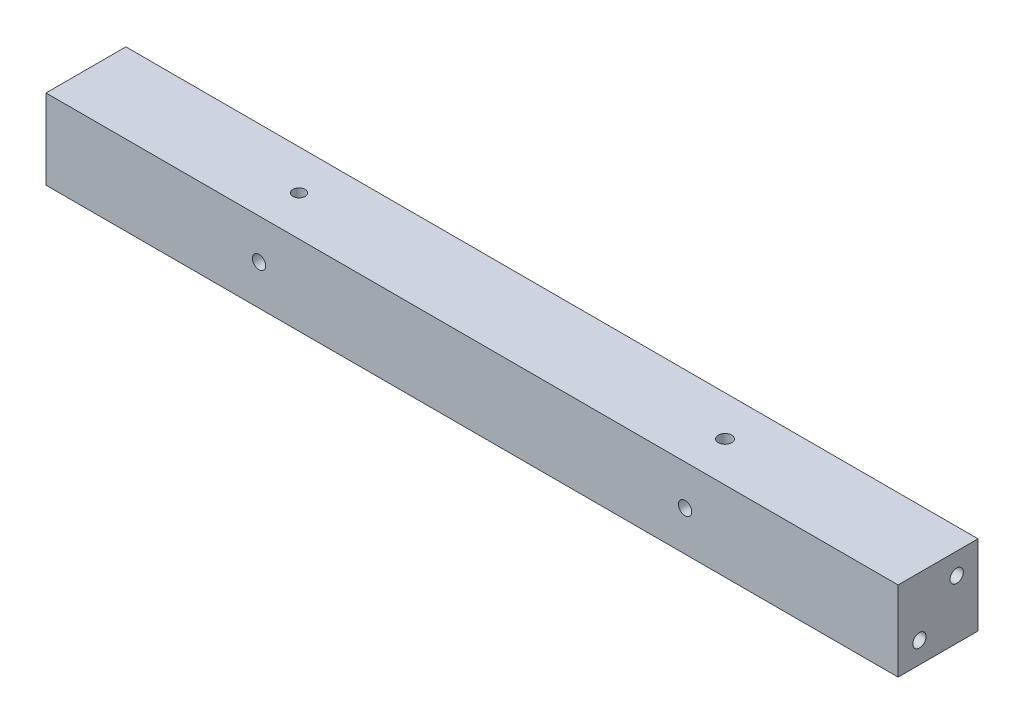
from build123d import *

# Parameters (mm, degrees)
SKETCH1_W           = 160
SKETCH1_H           = 15
BOSS_EXTRUDE1_DEPTH = 15
SKETCH2_R           = 1.25
CUT_EXTRUDE1_DEPTH  = 5
SKETCH3_R           = 1.145
SKETCH3_R_2         = 1.25
CUT_EXTRUDE2_DEPTH  = 5
CUT_EXTRUDE3_START  = -5
SKETCH4_R           = 1.25
CUT_EXTRUDE3_DEPTH  = 5
CUT_EXTRUDE4_START  = -5
SKETCH5_R           = 1.25
CUT_EXTRUDE4_DEPTH  = 5
SKETCH6_R           = 1.25
CUT_EXTRUDE5_DEPTH  = 10
CUT_EXTRUDE6_START  = -10
SKETCH7_R           = 1.25
CUT_EXTRUDE6_DEPTH  = 10


with BuildPart() as part:
    # Sketch1 → Boss-Extrude1 (new body)
    with BuildSketch(Plane.XY):
        with Locations((80, 7.5)):
            Rectangle(SKETCH1_W, SKETCH1_H)
    extrude(amount=BOSS_EXTRUDE1_DEPTH)

    # Sketch2 → Cut-Extrude1 (cut)
    with BuildSketch(Plane.XY.offset(15)):
        with Locations((40, 7.5)):
            Circle(SKETCH2_R)
        with Locations((120, 7.5)):
            Circle(SKETCH2_R)
    extrude(amount=-CUT_EXTRUDE1_DEPTH, mode=Mode.SUBTRACT)

    # Sketch3 → Cut-Extrude2 (cut)
    with BuildSketch(Plane(origin=(0, 15, 0), x_dir=(1, 0, 0), z_dir=(0, 1, 0))):
        with Locations((40, -7.5)):
            Circle(SKETCH3_R)
        with Locations((120, -7.5)):
            Circle(SKETCH3_R_2)
    extrude(amount=-CUT_EXTRUDE2_DEPTH, mode=Mode.SUBTRACT)

    # Sketch4 → Cut-Extrude3 (cut)
    with BuildSketch(Plane(origin=(0, 0, 0), x_dir=(-1, 0, 0), z_dir=(0, 0, -1)).offset(CUT_EXTRUDE3_START)):
        with Locations((-120, 7.5)):
            Circle(SKETCH4_R)
        with Locations((-40, 7.5)):
            Circle(SKETCH4_R)
    extrude(amount=CUT_EXTRUDE3_DEPTH, mode=Mode.SUBTRACT)

    # Sketch5 → Cut-Extrude4 (cut)
    with BuildSketch(Plane.XZ.offset(CUT_EXTRUDE4_START)):
        with Locations((40, 7.5)):
            Circle(SKETCH5_R)
        with Locations((120, 7.5)):
            Circle(SKETCH5_R)
    extrude(amount=CUT_EXTRUDE4_DEPTH, mode=Mode.SUBTRACT)

    # Sketch6 → Cut-Extrude5 (cut)
    with BuildSketch(Plane.ZY):
        with Locations((4, 11)):
            Circle(SKETCH6_R)
        with Locations((11, 4)):
            Circle(SKETCH6_R)
    extrude(amount=-CUT_EXTRUDE5_DEPTH, mode=Mode.SUBTRACT)

    # Sketch7 → Cut-Extrude6 (cut)
    with BuildSketch(Plane(origin=(160, 0, 0), x_dir=(0, 0, -1), z_dir=(1, 0, 0)).offset(CUT_EXTRUDE6_START)):
        with Locations((-4, 11)):
            Circle(SKETCH7_R)
        with Locations((-11, 4)):
            Circle(SKETCH7_R)
    extrude(amount=CUT_EXTRUDE6_DEPTH, mode=Mode.SUBTRACT)


solid = part.part
